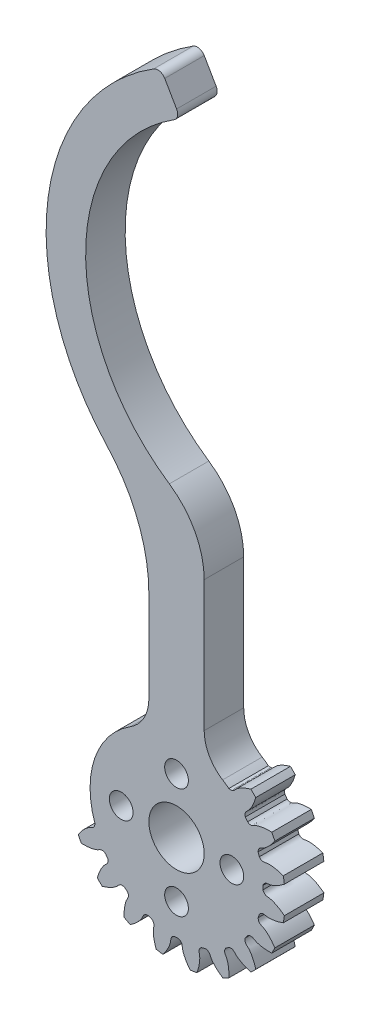
from build123d import *

# Parameters (mm, degrees)
SKETCH_1_R               = 13.75
EXTRUDE_1_DEPTH          = 5
CUT_EXTRUDE_1_DEPTH      = 21.077973005
PATTERN_CIRCULAR_1_COUNT = 20
EXTRUDE_2_DEPTH          = 5
SKETCH_4_R               = 3.5
SKETCH_4_R_2             = 1.5
CUT_EXTRUDE_2_DEPTH      = 20
CUT_EXTRUDE_START        = -10
CUT_EXTRUDE_5_DEPTH      = 10
FILLET_3_R               = 10
FILLET_4_R               = 1
CUT_EXTRUDE_7_DEPTH      = 10
FILLET_7_R               = 5
FILLET_8_R               = 20


with BuildPart() as part:
    # 草图1 → 凸台-拉伸1 (new body)
    with BuildSketch(Plane.XY):
        Circle(SKETCH_1_R)
    extrude(amount=EXTRUDE_1_DEPTH)

    # 草图2 → 切除-拉伸1 (cut, through all)
    with BuildSketch(Plane.XY):
        with BuildLine():
            ThreePointArc((0.241645751, 10.934830295), (0, 10.9375), (-0.241645751, 10.934830295))
            add(Edge.make_bspline(
                [(-0.241645751, 10.934830295), (-0.763986756, 11.11684439), (-0.696355124, 11.483892124), (-0.766121321, 11.837511753), (-0.773615233, 11.871945767), (-0.782888612, 11.910793269), (-0.794115121, 11.953996045), (-0.807473925, 12.001489371), (-0.823140069, 12.053203535), (-0.841287339, 12.109063416), (-0.862087187, 12.168988684), (-0.885708875, 12.232893806), (-0.912319248, 12.300688126), (-0.942082628, 12.372275913), (-0.975160664, 12.447556439), (-1.011712206, 12.526424039), (-1.051893167, 12.608768189), (-1.095856396, 12.694473577), (-1.143751548, 12.783420187), (-1.195724957, 12.87548338), (-1.251919512, 12.970533976), (-1.312474533, 13.068438347), (-1.377525652, 13.169058507), (-1.447204695, 13.272252205), (-1.521639564, 13.377873025), (-1.600954126, 13.485770488), (-1.685268101, 13.595790151), (-1.774696952, 13.707773716), (-1.869351783, 13.821559139), (-1.969339231, 13.936980743), (-2.074761371, 14.053869328), (-2.185715611, 14.172052294), (-2.302294605, 14.291353753), (-2.424586158, 14.411594659), (-2.552673133, 14.532592924), (-2.686633373, 14.654163553), (-2.826539612, 14.776118764), (-2.972459398, 14.898268124), (-3.124455015, 15.020418683), (-3.282583418, 15.142375102), (-3.446896124, 15.2639398), (-3.676841988, 15.427049835), (-3.854915516, 15.545415751), (-3.976447477, 15.622814825)],
                knots=[0, 0, 0, 0, 0.165916003, 0.170905922, 0.176663519, 0.183188797, 0.190481754, 0.198542391, 0.207370708, 0.216966704, 0.22733038, 0.238461736, 0.250360771, 0.263027487, 0.276461881, 0.290663956, 0.30563371, 0.321371144, 0.337876258, 0.355149051, 0.373189524, 0.391997677, 0.411573509, 0.431917021, 0.453028213, 0.474907084, 0.497553636, 0.520967867, 0.545149777, 0.570099367, 0.595816637, 0.622301587, 0.649554216, 0.677574526, 0.706362514, 0.735918183, 0.766241531, 0.797332559, 0.829191267, 0.861817654, 0.895211721, 0.929373468, 1, 1, 1, 1], degree=3))
            ThreePointArc((-3.976447477, 15.622814825), (0, 16.120932901), (3.976447477, 15.622814825))
            add(Edge.make_bspline(
                [(0.241645751, 10.934830295), (0.763986756, 11.11684439), (0.696355124, 11.483892124), (0.766121321, 11.837511753), (0.773615233, 11.871945767), (0.782888612, 11.910793269), (0.794115121, 11.953996045), (0.807473925, 12.001489371), (0.823140069, 12.053203535), (0.841287339, 12.109063416), (0.862087187, 12.168988684), (0.885708875, 12.232893806), (0.912319248, 12.300688126), (0.942082628, 12.372275913), (0.975160664, 12.447556439), (1.011712206, 12.526424039), (1.051893167, 12.608768189), (1.095856396, 12.694473577), (1.143751548, 12.783420187), (1.195724957, 12.87548338), (1.251919512, 12.970533976), (1.312474533, 13.068438347), (1.377525652, 13.169058507), (1.447204695, 13.272252205), (1.521639564, 13.377873025), (1.600954126, 13.485770488), (1.685268101, 13.595790151), (1.774696952, 13.707773716), (1.869351783, 13.821559139), (1.969339231, 13.936980743), (2.074761371, 14.053869328), (2.185715611, 14.172052294), (2.302294605, 14.291353753), (2.424586158, 14.411594659), (2.552673133, 14.532592924), (2.686633373, 14.654163553), (2.826539612, 14.776118764), (2.972459398, 14.898268124), (3.124455015, 15.020418683), (3.282583418, 15.142375102), (3.446896124, 15.2639398), (3.676841988, 15.427049835), (3.854915516, 15.545415751), (3.976447477, 15.622814825)],
                knots=[0, 0, 0, 0, 0.165916003, 0.170905922, 0.176663519, 0.183188797, 0.190481754, 0.198542391, 0.207370708, 0.216966704, 0.22733038, 0.238461736, 0.250360771, 0.263027487, 0.276461881, 0.290663956, 0.30563371, 0.321371144, 0.337876258, 0.355149051, 0.373189524, 0.391997677, 0.411573509, 0.431917021, 0.453028213, 0.474907084, 0.497553636, 0.520967867, 0.545149777, 0.570099367, 0.595816637, 0.622301587, 0.649554216, 0.677574526, 0.706362514, 0.735918183, 0.766241531, 0.797332559, 0.829191267, 0.861817654, 0.895211721, 0.929373468, 1, 1, 1, 1], degree=3))
        make_face()
    cut_extrude_1 = extrude(amount=CUT_EXTRUDE_1_DEPTH, mode=Mode.SUBTRACT)

    # 阵列(圆周)1: 切除-拉伸1 ×20 about axis
    pattern_circular_1_axis = Axis((0, 0, -1.5), (0, 0, 1))
    for i in range(1, PATTERN_CIRCULAR_1_COUNT):
        add(cut_extrude_1.rotate(pattern_circular_1_axis, i * 360 / PATTERN_CIRCULAR_1_COUNT), mode=Mode.SUBTRACT)

    # 草图6 → 凸台-拉伸2 (add)
    with BuildSketch(Plane(origin=(0, 0, 0), x_dir=(-1, 0, 0), z_dir=(0, 0, -1))):
        with BuildLine():
            Line((-3.5, 0), (3.5, 0))
            Line((3.5, 0), (3.5, 10.32690032))
            add(Edge.make_bspline(
                [(3.5, 10.32690032), (4.156413811, 10.291875113), (4.200761863, 10.688312594), (4.393103935, 11.03302397), (4.418885843, 11.076011904), (4.458931571, 11.138710403), (4.509766902, 11.213065778), (4.58267603, 11.311112911), (4.671237054, 11.420807284), (4.776478734, 11.5410308), (4.899365137, 11.670602183), (5.040791529, 11.808280759), (5.201581362, 11.952770029), (5.38248323, 12.10272148), (5.584168076, 12.256738531), (5.744241751, 12.369149234), (5.836552423, 12.430773747), (5.853360338, 12.441891848)],
                knots=[0.482278834, 0.482278834, 0.482278834, 0.482278834, 0.658484305, 0.663474224, 0.675757099, 0.683050056, 0.69993901, 0.719898682, 0.742929074, 0.769030183, 0.798202012, 0.83044456, 0.865757826, 0.904141811, 0.945596515, 0.990121938, 1, 1, 1, 1], degree=3))
            Line((5.853360338, 12.441891848), (3.5, 13.800605072))
            Line((3.5, 13.800605072), (3.5, 34.033226755))
            ThreePointArc((3.5, 34.033226755), (16.486586915, 59.101917824), (2, 83.33473671))
            Line((2, 83.33473671), (-0.5, 79.004609691))
            ThreePointArc((-0.5, 79.004609691), (11.441891872, 56.550924332), (-3.5, 35.971404539))
            Line((-3.5, 35.971404539), (-3.5, 13.800605072))
            Line((-3.5, 13.800605072), (-5.853360338, 12.441891848))
            add(Edge.make_bspline(
                [(-3.5, 10.32690032), (-4.156413811, 10.291875113), (-4.200761863, 10.688312594), (-4.393103935, 11.03302397), (-4.418885843, 11.076011904), (-4.458931571, 11.138710403), (-4.509766902, 11.213065778), (-4.58267603, 11.311112911), (-4.671237054, 11.420807284), (-4.776478734, 11.5410308), (-4.899365137, 11.670602183), (-5.040791529, 11.808280759), (-5.201581362, 11.952770029), (-5.38248323, 12.10272148), (-5.584168076, 12.256738531), (-5.744241751, 12.369149234), (-5.836552423, 12.430773747), (-5.853360338, 12.441891848)],
                knots=[-0.010289468, -0.010289468, -0.010289468, -0.010289468, 0.165916003, 0.170905922, 0.183188797, 0.190481754, 0.207370708, 0.22733038, 0.250360771, 0.276461881, 0.30563371, 0.337876258, 0.373189524, 0.411573509, 0.453028213, 0.497553636, 0.507431698, 0.507431698, 0.507431698, 0.507431698], degree=3))
            Line((-3.5, 10.32690032), (-3.5, 0))
        make_face()
    extrude(amount=-EXTRUDE_2_DEPTH)

    # 草图4 → 切除-拉伸2 (cut)
    with BuildSketch(Plane.XY.offset(5)):
        Circle(SKETCH_4_R)
        with Locations((0, 7)):
            Circle(SKETCH_4_R_2)
        with Locations((7, 0)):
            Circle(SKETCH_4_R_2)
        with Locations((0, -7)):
            Circle(SKETCH_4_R_2)
        with Locations((-7, 0)):
            Circle(SKETCH_4_R_2)
    extrude(amount=-CUT_EXTRUDE_2_DEPTH, mode=Mode.SUBTRACT)

    # 草图17 → 切除-拉伸5 (cut)
    with BuildSketch(Plane.XY.offset(5).offset(CUT_EXTRUDE_START)):
        with BuildLine():
            ThreePointArc((-10.324968963, -3.608867158), (-10.47431425, 3.149229626), (-6.622827503, 8.704427731))
            Line((-6.622827503, 8.704427731), (-10.596524004, 13.927084369))
            ThreePointArc((-10.596524004, 13.927084369), (-16.7589028, 5.038767402), (-16.519950341, -5.774187452))
            Line((-16.519950341, -5.774187452), (-10.324968963, -3.608867158))
        make_face()
    extrude(amount=CUT_EXTRUDE_5_DEPTH, mode=Mode.SUBTRACT)

    # 圆角3
    fillet_3_edges = [part.edges().sort_by_distance(p)[0] for p in [
        (3.5, 35.971404539, 2.5),
    ]]
    fillet(fillet_3_edges, radius=FILLET_3_R)

    # 圆角4
    fillet_4_edges = [part.edges().sort_by_distance(p)[0] for p in [
        (-2, 83.33473671, 2.5),
        (0.5, 79.004609691, 2.5),
    ]]
    fillet(fillet_4_edges, radius=FILLET_4_R)

    # 草图20 → 切除-拉伸7 (cut)
    with BuildSketch(Plane(origin=(0, 0, 0), x_dir=(-1, 0, 0), z_dir=(0, 0, -1))):
        with BuildLine():
            Line((-3.5, 10.362379372), (-3.5, 13.800605072))
            Line((-3.5, 13.800605072), (-5.853360338, 12.441891848))
            ThreePointArc((-5.853360338, 12.441891848), (-6.242369371, 12.251339708), (-6.625183064, 12.048628526))
            add(Edge.make_bspline(
                [(-6.231836465, 8.988499348), (-5.916238915, 9.442776183), (-6.1866993, 9.699971162), (-6.343702187, 10.03914452), (-6.36332593, 10.085270195), (-6.390511793, 10.154521122), (-6.420786297, 10.239352761), (-6.457253184, 10.355968144), (-6.493942932, 10.492092252), (-6.529346293, 10.647900169), (-6.561940927, 10.823477506), (-6.590196887, 11.018819297), (-6.61258127, 11.233829666), (-6.627563092, 11.468321604), (-6.633618126, 11.722017023), (-6.630471349, 11.9175927), (-6.626067777, 12.028495582), (-6.625183064, 12.048628526)],
                knots=[0.492568302, 0.492568302, 0.492568302, 0.492568302, 0.658484305, 0.663474224, 0.675757099, 0.683050056, 0.69993901, 0.719898682, 0.742929074, 0.769030183, 0.798202012, 0.83044456, 0.865757826, 0.904141811, 0.945596515, 0.990121938, 1, 1, 1, 1], degree=3))
            ThreePointArc((-6.231836465, 8.988499348), (-4.914167969, 9.771379607), (-3.5, 10.362379372))
        make_face()
        with BuildLine():
            Line((3.5, 13.800605072), (3.5, 10.362379372))
            ThreePointArc((3.5, 10.362379372), (4.914167969, 9.771379607), (6.231836465, 8.988499348))
            add(Edge.make_bspline(
                [(6.231836465, 8.988499348), (5.916238915, 9.442776183), (6.1866993, 9.699971162), (6.343702187, 10.03914452), (6.36332593, 10.085270195), (6.390511793, 10.154521122), (6.420786297, 10.239352761), (6.457253184, 10.355968144), (6.493942932, 10.492092252), (6.529346293, 10.647900169), (6.561940927, 10.823477506), (6.590196887, 11.018819297), (6.61258127, 11.233829666), (6.627563092, 11.468321604), (6.633618126, 11.722017023), (6.630471349, 11.9175927), (6.626067777, 12.028495582), (6.625183064, 12.048628526)],
                knots=[0, 0, 0, 0, 0.165916003, 0.170905922, 0.183188797, 0.190481754, 0.207370708, 0.22733038, 0.250360771, 0.276461881, 0.30563371, 0.337876258, 0.373189524, 0.411573509, 0.453028213, 0.497553636, 0.507431698, 0.507431698, 0.507431698, 0.507431698], degree=3))
            ThreePointArc((6.625183064, 12.048628526), (6.242369371, 12.251339708), (5.853360338, 12.441891848))
            Line((5.853360338, 12.441891848), (3.5, 13.800605072))
        make_face()
    extrude(amount=-CUT_EXTRUDE_7_DEPTH, mode=Mode.SUBTRACT)

    # 圆角7
    fillet_7_edges = [part.edges().sort_by_distance(p)[0] for p in [
        (-3.5, 10.362379372, 2.5),
        (3.5, 10.362379372, 2.5),
    ]]
    fillet(fillet_7_edges, radius=FILLET_7_R)

    # 圆角8
    fillet_8_edges = [part.edges().sort_by_distance(p)[0] for p in [
        (-3.5, 34.033226755, 2.5),
    ]]
    fillet(fillet_8_edges, radius=FILLET_8_R)


solid = part.part
